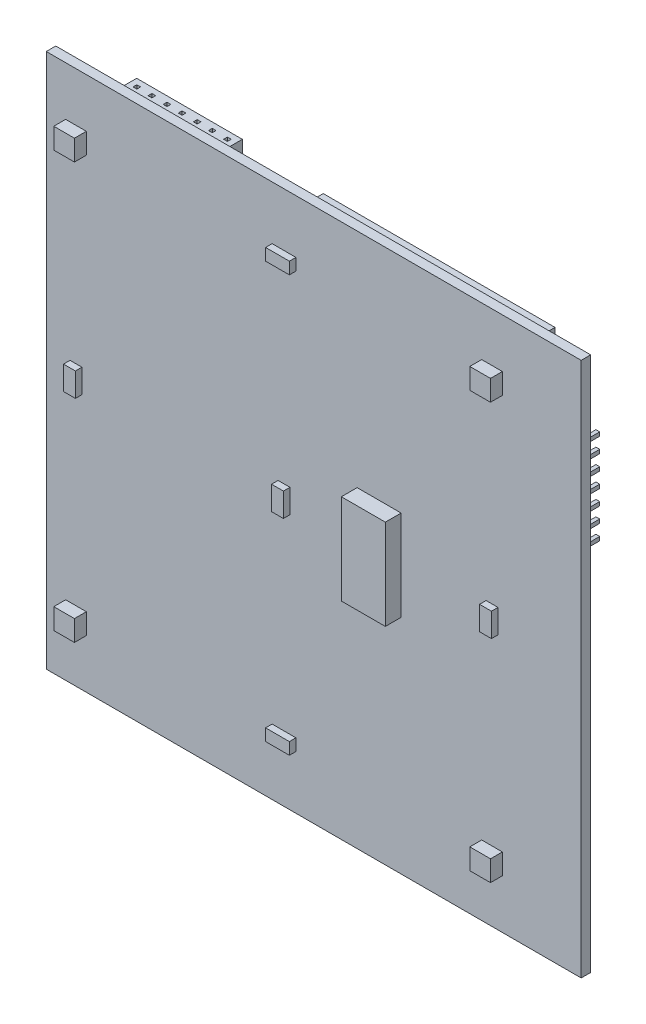
from build123d import *

# Parameters (mm, degrees)
SKETCH_1_W          = 90
SKETCH_1_H          = 90
EXTRUDE_1_DEPTH     = 1.6
SKETCH_4_W          = 17.78
SKETCH_4_H          = 8.5
SKETCH_4_W_2        = 2.5
SKETCH_4_H_2        = 17.78
SKETCH_4_W_3        = 8.5
EXTRUDE_2_DEPTH     = 2.5
SKETCH_5_W          = 0.64
SKETCH_5_H          = 0.64
EXTRUDE_3_DEPTH     = 6.1
SKETCH_6_W          = 3.48
SKETCH_6_H          = 3.48
EXTRUDE_4_DEPTH     = 2
SKETCH_7_W          = 2
SKETCH_7_H          = 4
SKETCH_7_W_2        = 4
SKETCH_7_H_2        = 2
EXTRUDE_5_DEPTH     = 1.1
SKETCH_8_W          = 7.4
SKETCH_8_H          = 15.2
EXTRUDE_6_DEPTH     = 2.65
SKETCH_9_W          = 0.64
SKETCH_9_H          = 0.64
CUT_EXTRUDE_1_DEPTH = 7.5
SKETCH_10_W         = 0.64
SKETCH_10_H         = 0.64
CUT_EXTRUDE_2_DEPTH = 7.5
SKETCH_11_W         = 0.64
SKETCH_11_H         = 0.64
CUT_EXTRUDE_3_DEPTH = 7.5
EXTRUDE_7_DEPTH     = 3
SKETCH_13_R         = 1
EXTRUDE_8_DEPTH     = 2


with BuildPart() as part:
    # ｽｹｯﾁ1 → ﾎﾞｽ - 押し出し1 (new body)
    with BuildSketch(Plane.XY):
        Rectangle(SKETCH_1_W, SKETCH_1_H)
    extrude(amount=EXTRUDE_1_DEPTH)

    # ｽｹｯﾁ4 → ﾎﾞｽ - 押し出し2 (add)
    with BuildSketch(Plane(origin=(0, 0, 0), x_dir=(-1, 0, 0), z_dir=(0, 0, -1))):
        with Locations((-15, -40.35)):
            Rectangle(SKETCH_4_W, SKETCH_4_H)
        with Locations((-37.6, 18)):
            Rectangle(SKETCH_4_W_2, SKETCH_4_H_2)
        with Locations((25, 40.35)):
            Rectangle(SKETCH_4_W, SKETCH_4_H)
        with Locations((40.35, 18)):
            Rectangle(SKETCH_4_W_3, SKETCH_4_H_2)
    extrude(amount=EXTRUDE_2_DEPTH)

    # ｽｹｯﾁ5 → ﾎﾞｽ - 押し出し3 (add)
    with BuildSketch(Plane(origin=(0, 0, -2.5), x_dir=(-1, 0, 0), z_dir=(0, 0, -1))):
        with Locations((-37.6, 18)):
            Rectangle(SKETCH_5_W, SKETCH_5_H)
        with Locations((-37.6, 15.46)):
            Rectangle(SKETCH_5_W, SKETCH_5_H)
        with Locations((-37.6, 12.92)):
            Rectangle(SKETCH_5_W, SKETCH_5_H)
        with Locations((-37.6, 10.38)):
            Rectangle(SKETCH_5_W, SKETCH_5_H)
        with Locations((-37.6, 20.54)):
            Rectangle(SKETCH_5_W, SKETCH_5_H)
        with Locations((-37.6, 23.08)):
            Rectangle(SKETCH_5_W, SKETCH_5_H)
        with Locations((-37.6, 25.62)):
            Rectangle(SKETCH_5_W, SKETCH_5_H)
    extrude(amount=EXTRUDE_3_DEPTH)

    # ｽｹｯﾁ6 → ﾎﾞｽ - 押し出し4 (add)
    with BuildSketch(Plane.XY.offset(1.6)):
        with Locations((-40, -35)):
            Rectangle(SKETCH_6_W, SKETCH_6_H)
        with Locations((-40, 35)):
            Rectangle(SKETCH_6_W, SKETCH_6_H)
        with Locations((30, -35)):
            Rectangle(SKETCH_6_W, SKETCH_6_H)
        with Locations((30, 35)):
            Rectangle(SKETCH_6_W, SKETCH_6_H)
    extrude(amount=EXTRUDE_4_DEPTH)

    # ｽｹｯﾁ7 → ﾎﾞｽ - 押し出し5 (add)
    with BuildSketch(Plane.XY.offset(1.6)):
        with Locations((-40, 0)):
            Rectangle(SKETCH_7_W, SKETCH_7_H)
        with Locations((30, 0)):
            Rectangle(SKETCH_7_W, SKETCH_7_H)
        with Locations((-5, 35)):
            Rectangle(SKETCH_7_W_2, SKETCH_7_H_2)
        with Locations((-5, -35)):
            Rectangle(SKETCH_7_W_2, SKETCH_7_H_2)
        with Locations((-5, 0)):
            Rectangle(SKETCH_7_W, SKETCH_7_H)
    extrude(amount=EXTRUDE_5_DEPTH)

    # ｽｹｯﾁ8 → ﾎﾞｽ - 押し出し6 (add)
    with BuildSketch(Plane.XY.offset(1.6)):
        with Locations((11, 0)):
            Rectangle(SKETCH_8_W, SKETCH_8_H)
    extrude(amount=EXTRUDE_6_DEPTH)

    # ｽｹｯﾁ9 → ｶｯﾄ - 押し出し1 (cut)
    with BuildSketch(Plane.XZ.offset(44.6)):
        with Locations((15, -1.25)):
            Rectangle(SKETCH_9_W, SKETCH_9_H)
        with Locations((12.46, -1.25)):
            Rectangle(SKETCH_9_W, SKETCH_9_H)
        with Locations((9.92, -1.25)):
            Rectangle(SKETCH_9_W, SKETCH_9_H)
        with Locations((7.38, -1.25)):
            Rectangle(SKETCH_9_W, SKETCH_9_H)
        with Locations((17.54, -1.25)):
            Rectangle(SKETCH_9_W, SKETCH_9_H)
        with Locations((20.08, -1.25)):
            Rectangle(SKETCH_9_W, SKETCH_9_H)
        with Locations((22.62, -1.25)):
            Rectangle(SKETCH_9_W, SKETCH_9_H)
    extrude(amount=-CUT_EXTRUDE_1_DEPTH, mode=Mode.SUBTRACT)

    # ｽｹｯﾁ10 → ｶｯﾄ - 押し出し2 (cut)
    with BuildSketch(Plane.ZY.offset(44.6)):
        with Locations((-1.25, 18)):
            Rectangle(SKETCH_10_W, SKETCH_10_H)
        with Locations((-1.25, 25.62)):
            Rectangle(SKETCH_10_W, SKETCH_10_H)
        with Locations((-1.25, 23.08)):
            Rectangle(SKETCH_10_W, SKETCH_10_H)
        with Locations((-1.25, 20.54)):
            Rectangle(SKETCH_10_W, SKETCH_10_H)
        with Locations((-1.25, 15.46)):
            Rectangle(SKETCH_10_W, SKETCH_10_H)
        with Locations((-1.25, 12.92)):
            Rectangle(SKETCH_10_W, SKETCH_10_H)
        with Locations((-1.25, 10.38)):
            Rectangle(SKETCH_10_W, SKETCH_10_H)
    extrude(amount=-CUT_EXTRUDE_2_DEPTH, mode=Mode.SUBTRACT)

    # ｽｹｯﾁ11 → ｶｯﾄ - 押し出し3 (cut)
    with BuildSketch(Plane(origin=(0, 44.6, 0), x_dir=(1, 0, 0), z_dir=(0, 1, 0))):
        with Locations((-25, 1.25)):
            Rectangle(SKETCH_11_W, SKETCH_11_H)
        with Locations((-32.62, 1.25)):
            Rectangle(SKETCH_11_W, SKETCH_11_H)
        with Locations((-30.08, 1.25)):
            Rectangle(SKETCH_11_W, SKETCH_11_H)
        with Locations((-27.54, 1.25)):
            Rectangle(SKETCH_11_W, SKETCH_11_H)
        with Locations((-22.46, 1.25)):
            Rectangle(SKETCH_11_W, SKETCH_11_H)
        with Locations((-19.92, 1.25)):
            Rectangle(SKETCH_11_W, SKETCH_11_H)
        with Locations((-17.38, 1.25)):
            Rectangle(SKETCH_11_W, SKETCH_11_H)
    extrude(amount=-CUT_EXTRUDE_3_DEPTH, mode=Mode.SUBTRACT)

    # ｽｹｯﾁ12 → ﾎﾞｽ - 押し出し7 (add)
    with BuildSketch(Plane(origin=(0, 0, 0), x_dir=(-1, 0, 0), z_dir=(0, 0, -1))):
        Polygon((-23, 30), (-24, 31.732050808), (-26, 31.732050808), (-27, 30), (-26, 28.267949192), (-24, 28.267949192), align=None)
        Polygon((37, 30), (36, 31.732050808), (34, 31.732050808), (33, 30), (34, 28.267949192), (36, 28.267949192), align=None)
        Polygon((37, -30), (36, -28.267949192), (34, -28.267949192), (33, -30), (34, -31.732050808), (36, -31.732050808), align=None)
        Polygon((-23, -30), (-24, -28.267949192), (-26, -28.267949192), (-27, -30), (-26, -31.732050808), (-24, -31.732050808), align=None)
    extrude(amount=EXTRUDE_7_DEPTH)

    # ｽｹｯﾁ13 → ﾎﾞｽ - 押し出し8 (add)
    with BuildSketch(Plane(origin=(0, 0, -3), x_dir=(-1, 0, 0), z_dir=(0, 0, -1))):
        Polygon((-34, 41), (-34, 0), (-36, 0), (-36, -39), (5, -39), (5, -41), (44, -41), (44, 0), (46, 0), (46, 39), (5, 39), (5, 41), align=None)
        with Locations((-25, 30)):
            Circle(SKETCH_13_R, mode=Mode.SUBTRACT)
        with Locations((-25, -30)):
            Circle(SKETCH_13_R, mode=Mode.SUBTRACT)
        with Locations((35, -30)):
            Circle(SKETCH_13_R, mode=Mode.SUBTRACT)
        with Locations((35, 30)):
            Circle(SKETCH_13_R, mode=Mode.SUBTRACT)
    extrude(amount=EXTRUDE_8_DEPTH)


solid = part.part
